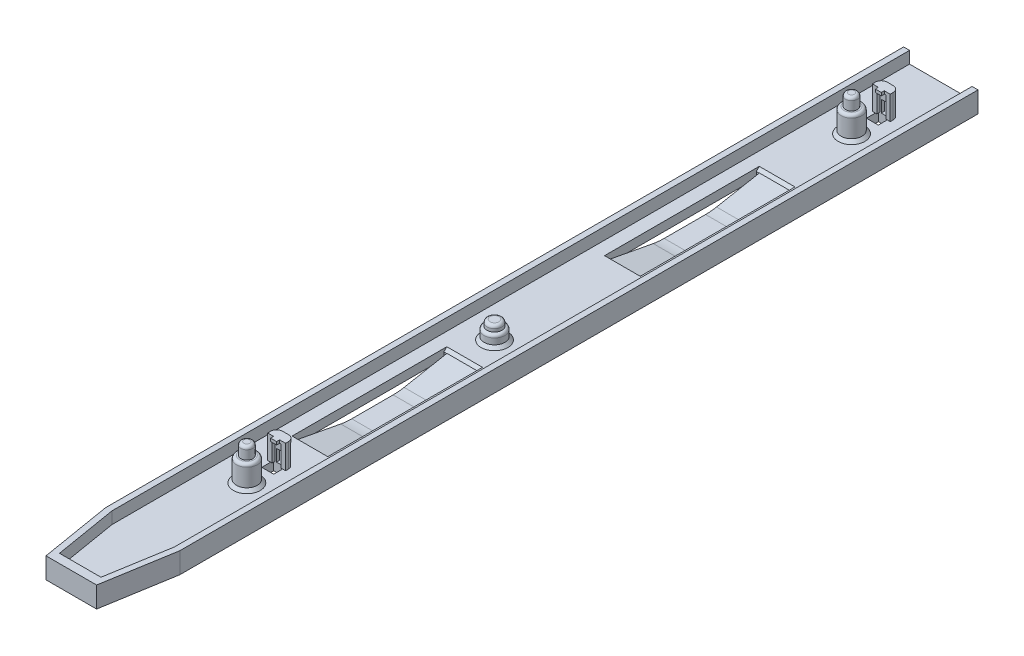
from build123d import *

# Parameters (mm, degrees)
SKETCH_1_W                   = 12.5
SKETCH_1_H                   = 146.1
EXTRUDE_1_DEPTH              = 3.5
CUT_EXTRUDE_1_DEPTH          = 74.400374658
CUT_EXTRUDE_2_DEPTH          = 2
SKETCH_7_W                   = 6
SKETCH_7_H                   = 25
CUT_EXTRUDE_3_DEPTH          = 74.344154505
EXTRUDE_2_DEPTH              = 2.5
PATTERN_LINEAR_1_COUNT       = 2
PATTERN_LINEAR_1_PITCH       = 52.5
FILLET_1_R                   = 10
CHAMFER_1_SIZE               = 0.5
SKETCH_11_R                  = 1.75
EXTRUDE_4_DEPTH              = 6
SKETCH_12_OUTSIDE_W          = 43.882
SKETCH_12_OUTSIDE_H          = 177.482
SKETCH_12_OUTSIDE_R          = 1
CUT_EXTRUDE_5_DEPTH          = 2
FILLET_3_R                   = 0.5
CHAMFER_3_SIZE               = 0.5
SKETCH_9_R                   = 1.75
EXTRUDE_3_DEPTH              = 3
CUT_EXTRUDE_START            = -1
SKETCH_10_R                  = 1.75
SKETCH_10_R_2                = 1.25
CUT_EXTRUDE_4_DEPTH          = 1
FILLET_2_R                   = 0.5
CHAMFER_2_SIZE               = 0.5
SKETCH_13_W                  = 2
SKETCH_13_H                  = 2
CUT_EXTRUDE_6_DEPTH          = 74.699491179
EXTRUDE_5_DEPTH              = 4
FILLET_4_R                   = 1
SKETCH_15_W                  = 1.5
SKETCH_15_H                  = 1
CUT_EXTRUDE_7_DEPTH          = 5
SKETCH_16_W                  = 3.5
SKETCH_16_H                  = 3.5
CUT_EXTRUDE_8_DEPTH          = 0.5
SKETCH_17_W                  = 1
SKETCH_17_H                  = 2
CUT_EXTRUDE_9_DEPTH          = 0.5
PATTERN_LINEAR_9_OUTLINE_W   = 2
PATTERN_LINEAR_9_OUTLINE_H   = 2
PATTERN_LINEAR_9_DEPTH       = 1.5
PATTERN_START                = 1.5
PATTERN_LINEAR_9_2_DEPTH     = 4
PATTERN_START_2              = 5
PATTERN_LINEAR_9_3_DEPTH     = 0.5
PATTERN_START_3              = 3.5
PATTERN_LINEAR_9_4_OUTLINE_W = 1
PATTERN_LINEAR_9_4_OUTLINE_H = 0.5
PATTERN_LINEAR_9_4_DEPTH     = 1.5
SKETCH_18_R                  = 0.5
CUT_EXTRUDE_10_DEPTH         = 2


# Read off the part's stored shape, not the designer's step: 阵列(线性)9
# Some blends are built 0.0001 mm under size
with BuildPart() as part:
    # 草图1 → 凸台-拉伸1 (new body)
    with BuildSketch(Plane(origin=(0, 0, 0), x_dir=(1, 0, 0), z_dir=(0, 1, 0))):
        Rectangle(SKETCH_1_W, SKETCH_1_H)
    extrude(amount=EXTRUDE_1_DEPTH)

    # 草图3 → 切除-拉伸1 (cut, through all)
    with BuildSketch(Plane(origin=(0, 3.5, 0), x_dir=(1, 0, 0), z_dir=(0, 1, 0))):
        Polygon((-6.25, -73.05), (-6.25, -61.05), (-4.25, -73.05), align=None)
    cut_extrude_1 = extrude(amount=-CUT_EXTRUDE_1_DEPTH, mode=Mode.SUBTRACT)

    # 镜向1: 切除-拉伸1 across plane
    add(cut_extrude_1.mirror(Plane(origin=(0, 0, 0), x_dir=(0, 0, 1), z_dir=(1, 0, 0))), mode=Mode.SUBTRACT)

    # 草图4 → 切除-拉伸2 (cut)
    with BuildSketch(Plane(origin=(0, 3.5, 0), x_dir=(1, 0, 0), z_dir=(0, 1, 0))):
        Polygon((-5.25, 73.05), (-5.25, -60.96723747), (-3.486206245, -71.55), (3.486206245, -71.55), (5.25, -60.96723747), (5.25, 73.05), align=None)
    extrude(amount=-CUT_EXTRUDE_2_DEPTH, mode=Mode.SUBTRACT)

    # 草图7 → 切除-拉伸3 (cut, through all)
    with BuildSketch(Plane(origin=(0, 1.5, 0), x_dir=(1, 0, 0), z_dir=(0, 1, 0))):
        with Locations((0, 32.55)):
            Rectangle(SKETCH_7_W, SKETCH_7_H)
        with Locations((0, -19.95)):
            Rectangle(SKETCH_7_W, SKETCH_7_H)
    extrude(amount=-CUT_EXTRUDE_3_DEPTH, mode=Mode.SUBTRACT)

    # 草图8 → 凸台-拉伸2 (add, symmetric)
    with BuildSketch(Plane(origin=(0, 0, 0), x_dir=(0, 0, -1), z_dir=(1, 0, 0))):
        Polygon((45.05, 0), (37.05, -1.5), (28.05, -1.5), (20.05, 0), (20.05, 1.017426287), (28.142940199, -0.5), (36.957059801, -0.5), (45.05, 1.017426287), align=None)
    extrude_2 = extrude(amount=EXTRUDE_2_DEPTH, both=True)

    # 阵列(线性)1: 凸台-拉伸2 ×2
    with Locations(*[(0, 0, i * PATTERN_LINEAR_1_PITCH) for i in range(1, PATTERN_LINEAR_1_COUNT)]):
        add(extrude_2)

    # 圆角1
    fillet_1_edges = [part.edges().sort_by_distance(p)[0] for p in [
        (0, -1.5, 24.45),
        (0, -1.5, 15.45),
        (0, -0.5, 15.542940199),
        (0, -0.5, 24.357059801),
        (0, -1.5, -28.05),
        (0, -1.5, -37.05),
        (0, -0.5, -36.957059801),
        (0, -0.5, -28.142940199),
    ]]
    fillet(fillet_1_edges, radius=FILLET_1_R)

    # 倒角1
    # the kernel refuses this chamfer: 0.5 mm, written as the material it takes off along each edge
    with BuildSketch(Plane(origin=(3, 1.5, 32.45), x_dir=(0, -0.999621916911297, -0.02749587661058218), z_dir=(-1, 0, 0))) as chamfer_1_piece_1_section:
        Polygon((CHAMFER_1_SIZE * 0.999621916911, CHAMFER_1_SIZE * 0.0274958766106), (-CHAMFER_1_SIZE * 0.0274958766106, CHAMFER_1_SIZE * 0.999621916911), (0, 0), align=None)
    chamfer_1_piece_1 = extrude(amount=6, mode=Mode.PRIVATE)
    chamfer_1_piece_1 = split(chamfer_1_piece_1, bisect_by=Plane(origin=(2.5, 1.004745153, 32.442397082), z_dir=(1, 0, 0)), keep=Keep.TOP, mode=Mode.PRIVATE)
    chamfer_1_piece_1 = split(chamfer_1_piece_1, bisect_by=Plane(origin=(2.75, 1.015618475, 32.440358334), z_dir=(0, -0.982872186934322, 0.18428853505018503)), keep=Keep.TOP, mode=Mode.PRIVATE)
    add(chamfer_1_piece_1, mode=Mode.SUBTRACT)
    with BuildSketch(Plane(origin=(3, 1.5, 32.45), x_dir=(0, -0.999621916911297, -0.02749587661058218), z_dir=(-1, 0, 0))) as chamfer_1_piece_2_section:
        Polygon((CHAMFER_1_SIZE * 0.999621916911, CHAMFER_1_SIZE * 0.0274958766106), (-CHAMFER_1_SIZE * 0.0274958766106, CHAMFER_1_SIZE * 0.999621916911), (0, 0), align=None)
    chamfer_1_piece_2 = extrude(amount=6, mode=Mode.PRIVATE)
    chamfer_1_piece_2 = split(chamfer_1_piece_2, bisect_by=Plane(origin=(2.5, 1.336949291, 32.615860775), z_dir=(1, 0, 0)), keep=Keep.TOP, mode=Mode.PRIVATE)
    chamfer_1_piece_2 = split(chamfer_1_piece_2, bisect_by=Plane(origin=(2.75, 1.058320718, 32.668103633), z_dir=(0, 0.982872186934322, -0.18428853505018503)), keep=Keep.TOP, mode=Mode.PRIVATE)
    add(chamfer_1_piece_2, mode=Mode.SUBTRACT)
    with BuildSketch(Plane(origin=(3, 1.5, 32.45), x_dir=(0, -0.999621916911297, -0.02749587661058218), z_dir=(-1, 0, 0))) as chamfer_1_piece_3_section:
        Polygon((CHAMFER_1_SIZE * 0.999621916911, CHAMFER_1_SIZE * 0.0274958766106), (-CHAMFER_1_SIZE * 0.0274958766106, CHAMFER_1_SIZE * 0.999621916911), (0, 0), align=None)
    chamfer_1_piece_3 = extrude(amount=6, mode=Mode.PRIVATE)
    chamfer_1_piece_3 = split(chamfer_1_piece_3, bisect_by=Plane(origin=(-2.5, 1.336949291, 32.615860775), z_dir=(1, 0, 0)), keep=Keep.TOP, mode=Mode.PRIVATE)
    chamfer_1_piece_3 = split(chamfer_1_piece_3, bisect_by=Plane(origin=(2.5, 1.336949291, 32.615860775), z_dir=(-1, 0, 0)), keep=Keep.TOP, mode=Mode.PRIVATE)
    chamfer_1_piece_3 = split(chamfer_1_piece_3, bisect_by=Plane(origin=(0, 1.058320718, 32.668103633), z_dir=(0, 0.982872186934322, -0.18428853505018503)), keep=Keep.TOP, mode=Mode.PRIVATE)
    add(chamfer_1_piece_3, mode=Mode.SUBTRACT)
    with BuildSketch(Plane(origin=(3, 1.5, 32.45), x_dir=(0, -0.999621916911297, -0.02749587661058218), z_dir=(-1, 0, 0))) as chamfer_1_piece_4_section:
        Polygon((CHAMFER_1_SIZE * 0.999621916911, CHAMFER_1_SIZE * 0.0274958766106), (-CHAMFER_1_SIZE * 0.0274958766106, CHAMFER_1_SIZE * 0.999621916911), (0, 0), align=None)
    chamfer_1_piece_4 = extrude(amount=6, mode=Mode.PRIVATE)
    chamfer_1_piece_4 = split(chamfer_1_piece_4, bisect_by=Plane(origin=(-2.5, 1.004745153, 32.442397082), z_dir=(-1, 0, 0)), keep=Keep.TOP, mode=Mode.PRIVATE)
    chamfer_1_piece_4 = split(chamfer_1_piece_4, bisect_by=Plane(origin=(-2.75, 1.015618475, 32.440358334), z_dir=(0, -0.982872186934322, 0.18428853505018503)), keep=Keep.TOP, mode=Mode.PRIVATE)
    add(chamfer_1_piece_4, mode=Mode.SUBTRACT)
    with BuildSketch(Plane(origin=(3, 1.5, 32.45), x_dir=(0, -0.999621916911297, -0.02749587661058218), z_dir=(-1, 0, 0))) as chamfer_1_piece_5_section:
        Polygon((CHAMFER_1_SIZE * 0.999621916911, CHAMFER_1_SIZE * 0.0274958766106), (-CHAMFER_1_SIZE * 0.0274958766106, CHAMFER_1_SIZE * 0.999621916911), (0, 0), align=None)
    chamfer_1_piece_5 = extrude(amount=6, mode=Mode.PRIVATE)
    chamfer_1_piece_5 = split(chamfer_1_piece_5, bisect_by=Plane(origin=(-2.5, 1.336949291, 32.615860775), z_dir=(-1, 0, 0)), keep=Keep.TOP, mode=Mode.PRIVATE)
    chamfer_1_piece_5 = split(chamfer_1_piece_5, bisect_by=Plane(origin=(-2.75, 1.058320718, 32.668103633), z_dir=(0, 0.982872186934322, -0.18428853505018503)), keep=Keep.TOP, mode=Mode.PRIVATE)
    add(chamfer_1_piece_5, mode=Mode.SUBTRACT)
    with BuildSketch(Plane(origin=(3, 1.5, -20.05), x_dir=(0, -0.9996219169112968, -0.02749587661058908), z_dir=(-1, 0, 0))) as chamfer_1_piece_6_section:
        Polygon((CHAMFER_1_SIZE * 0.999621916911, CHAMFER_1_SIZE * 0.0274958766106), (-CHAMFER_1_SIZE * 0.0274958766106, CHAMFER_1_SIZE * 0.999621916911), (0, 0), align=None)
    chamfer_1_piece_6 = extrude(amount=6, mode=Mode.PRIVATE)
    chamfer_1_piece_6 = split(chamfer_1_piece_6, bisect_by=Plane(origin=(2.75, 1.015618475, -20.059641666), z_dir=(0, -0.982872186934322, 0.18428853505018503)), keep=Keep.TOP, mode=Mode.PRIVATE)
    chamfer_1_piece_6 = split(chamfer_1_piece_6, bisect_by=Plane(origin=(2.5, 1.004745153, -20.057602918), z_dir=(1, 0, 0)), keep=Keep.TOP, mode=Mode.PRIVATE)
    add(chamfer_1_piece_6, mode=Mode.SUBTRACT)
    with BuildSketch(Plane(origin=(3, 1.5, -20.05), x_dir=(0, -0.9996219169112968, -0.02749587661058908), z_dir=(-1, 0, 0))) as chamfer_1_piece_7_section:
        Polygon((CHAMFER_1_SIZE * 0.999621916911, CHAMFER_1_SIZE * 0.0274958766106), (-CHAMFER_1_SIZE * 0.0274958766106, CHAMFER_1_SIZE * 0.999621916911), (0, 0), align=None)
    chamfer_1_piece_7 = extrude(amount=6, mode=Mode.PRIVATE)
    chamfer_1_piece_7 = split(chamfer_1_piece_7, bisect_by=Plane(origin=(2.75, 1.058320718, -19.831896367), z_dir=(0, 0.982872186934322, -0.18428853505018503)), keep=Keep.TOP, mode=Mode.PRIVATE)
    chamfer_1_piece_7 = split(chamfer_1_piece_7, bisect_by=Plane(origin=(2.5, 1.336949291, -19.884139225), z_dir=(1, 0, 0)), keep=Keep.TOP, mode=Mode.PRIVATE)
    add(chamfer_1_piece_7, mode=Mode.SUBTRACT)
    with BuildSketch(Plane(origin=(3, 1.5, -20.05), x_dir=(0, -0.9996219169112968, -0.02749587661058908), z_dir=(-1, 0, 0))) as chamfer_1_piece_8_section:
        Polygon((CHAMFER_1_SIZE * 0.999621916911, CHAMFER_1_SIZE * 0.0274958766106), (-CHAMFER_1_SIZE * 0.0274958766106, CHAMFER_1_SIZE * 0.999621916911), (0, 0), align=None)
    chamfer_1_piece_8 = extrude(amount=6, mode=Mode.PRIVATE)
    chamfer_1_piece_8 = split(chamfer_1_piece_8, bisect_by=Plane(origin=(-2.5, 1.336949291, -19.884139225), z_dir=(1, 0, 0)), keep=Keep.TOP, mode=Mode.PRIVATE)
    chamfer_1_piece_8 = split(chamfer_1_piece_8, bisect_by=Plane(origin=(0, 1.058320718, -19.831896367), z_dir=(0, 0.982872186934322, -0.18428853505018503)), keep=Keep.TOP, mode=Mode.PRIVATE)
    chamfer_1_piece_8 = split(chamfer_1_piece_8, bisect_by=Plane(origin=(2.5, 1.336949291, -19.884139225), z_dir=(-1, 0, 0)), keep=Keep.TOP, mode=Mode.PRIVATE)
    add(chamfer_1_piece_8, mode=Mode.SUBTRACT)
    with BuildSketch(Plane(origin=(3, 1.5, -20.05), x_dir=(0, -0.9996219169112968, -0.02749587661058908), z_dir=(-1, 0, 0))) as chamfer_1_piece_9_section:
        Polygon((CHAMFER_1_SIZE * 0.999621916911, CHAMFER_1_SIZE * 0.0274958766106), (-CHAMFER_1_SIZE * 0.0274958766106, CHAMFER_1_SIZE * 0.999621916911), (0, 0), align=None)
    chamfer_1_piece_9 = extrude(amount=6, mode=Mode.PRIVATE)
    chamfer_1_piece_9 = split(chamfer_1_piece_9, bisect_by=Plane(origin=(-2.5, 1.004745153, -20.057602918), z_dir=(-1, 0, 0)), keep=Keep.TOP, mode=Mode.PRIVATE)
    chamfer_1_piece_9 = split(chamfer_1_piece_9, bisect_by=Plane(origin=(-2.75, 1.015618475, -20.059641666), z_dir=(0, -0.982872186934322, 0.18428853505018503)), keep=Keep.TOP, mode=Mode.PRIVATE)
    add(chamfer_1_piece_9, mode=Mode.SUBTRACT)
    with BuildSketch(Plane(origin=(3, 1.5, -20.05), x_dir=(0, -0.9996219169112968, -0.02749587661058908), z_dir=(-1, 0, 0))) as chamfer_1_piece_10_section:
        Polygon((CHAMFER_1_SIZE * 0.999621916911, CHAMFER_1_SIZE * 0.0274958766106), (-CHAMFER_1_SIZE * 0.0274958766106, CHAMFER_1_SIZE * 0.999621916911), (0, 0), align=None)
    chamfer_1_piece_10 = extrude(amount=6, mode=Mode.PRIVATE)
    chamfer_1_piece_10 = split(chamfer_1_piece_10, bisect_by=Plane(origin=(-2.5, 1.336949291, -19.884139225), z_dir=(-1, 0, 0)), keep=Keep.TOP, mode=Mode.PRIVATE)
    chamfer_1_piece_10 = split(chamfer_1_piece_10, bisect_by=Plane(origin=(-2.75, 1.058320718, -19.831896367), z_dir=(0, 0.982872186934322, -0.18428853505018503)), keep=Keep.TOP, mode=Mode.PRIVATE)
    add(chamfer_1_piece_10, mode=Mode.SUBTRACT)
    with BuildSketch(Plane(origin=(-3, 1.5, -45.05), x_dir=(0, -0.999621916911297, 0.02749587661058218), z_dir=(1, 0, 0))) as chamfer_1_piece_11_section:
        Polygon((CHAMFER_1_SIZE * 0.999621916911, CHAMFER_1_SIZE * 0.0274958766106), (-CHAMFER_1_SIZE * 0.0274958766106, CHAMFER_1_SIZE * 0.999621916911), (0, 0), align=None)
    chamfer_1_piece_11 = extrude(amount=6, mode=Mode.PRIVATE)
    chamfer_1_piece_11 = split(chamfer_1_piece_11, bisect_by=Plane(origin=(-2.75, 1.015618475, -45.040358334), z_dir=(0, -0.982872186934322, -0.1842885350501852)), keep=Keep.TOP, mode=Mode.PRIVATE)
    chamfer_1_piece_11 = split(chamfer_1_piece_11, bisect_by=Plane(origin=(-2.5, 1.004745153, -45.042397082), z_dir=(-1, 0, 0)), keep=Keep.TOP, mode=Mode.PRIVATE)
    add(chamfer_1_piece_11, mode=Mode.SUBTRACT)
    with BuildSketch(Plane(origin=(-3, 1.5, -45.05), x_dir=(0, -0.999621916911297, 0.02749587661058218), z_dir=(1, 0, 0))) as chamfer_1_piece_12_section:
        Polygon((CHAMFER_1_SIZE * 0.999621916911, CHAMFER_1_SIZE * 0.0274958766106), (-CHAMFER_1_SIZE * 0.0274958766106, CHAMFER_1_SIZE * 0.999621916911), (0, 0), align=None)
    chamfer_1_piece_12 = extrude(amount=6, mode=Mode.PRIVATE)
    chamfer_1_piece_12 = split(chamfer_1_piece_12, bisect_by=Plane(origin=(-2.75, 1.058320718, -45.268103633), z_dir=(0, 0.982872186934322, 0.1842885350501852)), keep=Keep.TOP, mode=Mode.PRIVATE)
    chamfer_1_piece_12 = split(chamfer_1_piece_12, bisect_by=Plane(origin=(-2.5, 1.336949291, -45.215860775), z_dir=(-1, 0, 0)), keep=Keep.TOP, mode=Mode.PRIVATE)
    add(chamfer_1_piece_12, mode=Mode.SUBTRACT)
    with BuildSketch(Plane(origin=(-3, 1.5, -45.05), x_dir=(0, -0.999621916911297, 0.02749587661058218), z_dir=(1, 0, 0))) as chamfer_1_piece_13_section:
        Polygon((CHAMFER_1_SIZE * 0.999621916911, CHAMFER_1_SIZE * 0.0274958766106), (-CHAMFER_1_SIZE * 0.0274958766106, CHAMFER_1_SIZE * 0.999621916911), (0, 0), align=None)
    chamfer_1_piece_13 = extrude(amount=6, mode=Mode.PRIVATE)
    chamfer_1_piece_13 = split(chamfer_1_piece_13, bisect_by=Plane(origin=(2.5, 1.336949291, -45.215860775), z_dir=(-1, 0, 0)), keep=Keep.TOP, mode=Mode.PRIVATE)
    chamfer_1_piece_13 = split(chamfer_1_piece_13, bisect_by=Plane(origin=(0, 1.058320718, -45.268103633), z_dir=(0, 0.982872186934322, 0.1842885350501852)), keep=Keep.TOP, mode=Mode.PRIVATE)
    chamfer_1_piece_13 = split(chamfer_1_piece_13, bisect_by=Plane(origin=(-2.5, 1.336949291, -45.215860775), z_dir=(1, 0, 0)), keep=Keep.TOP, mode=Mode.PRIVATE)
    add(chamfer_1_piece_13, mode=Mode.SUBTRACT)
    with BuildSketch(Plane(origin=(-3, 1.5, -45.05), x_dir=(0, -0.999621916911297, 0.02749587661058218), z_dir=(1, 0, 0))) as chamfer_1_piece_14_section:
        Polygon((CHAMFER_1_SIZE * 0.999621916911, CHAMFER_1_SIZE * 0.0274958766106), (-CHAMFER_1_SIZE * 0.0274958766106, CHAMFER_1_SIZE * 0.999621916911), (0, 0), align=None)
    chamfer_1_piece_14 = extrude(amount=6, mode=Mode.PRIVATE)
    chamfer_1_piece_14 = split(chamfer_1_piece_14, bisect_by=Plane(origin=(2.5, 1.004745153, -45.042397082), z_dir=(1, 0, 0)), keep=Keep.TOP, mode=Mode.PRIVATE)
    chamfer_1_piece_14 = split(chamfer_1_piece_14, bisect_by=Plane(origin=(2.75, 1.015618475, -45.040358334), z_dir=(0, -0.982872186934322, -0.1842885350501852)), keep=Keep.TOP, mode=Mode.PRIVATE)
    add(chamfer_1_piece_14, mode=Mode.SUBTRACT)
    with BuildSketch(Plane(origin=(-3, 1.5, -45.05), x_dir=(0, -0.999621916911297, 0.02749587661058218), z_dir=(1, 0, 0))) as chamfer_1_piece_15_section:
        Polygon((CHAMFER_1_SIZE * 0.999621916911, CHAMFER_1_SIZE * 0.0274958766106), (-CHAMFER_1_SIZE * 0.0274958766106, CHAMFER_1_SIZE * 0.999621916911), (0, 0), align=None)
    chamfer_1_piece_15 = extrude(amount=6, mode=Mode.PRIVATE)
    chamfer_1_piece_15 = split(chamfer_1_piece_15, bisect_by=Plane(origin=(2.5, 1.336949291, -45.215860775), z_dir=(1, 0, 0)), keep=Keep.TOP, mode=Mode.PRIVATE)
    chamfer_1_piece_15 = split(chamfer_1_piece_15, bisect_by=Plane(origin=(2.75, 1.058320718, -45.268103633), z_dir=(0, 0.982872186934322, 0.1842885350501852)), keep=Keep.TOP, mode=Mode.PRIVATE)
    add(chamfer_1_piece_15, mode=Mode.SUBTRACT)
    with BuildSketch(Plane(origin=(-3, 1.5, 7.45), x_dir=(0, -0.9996219169112968, 0.02749587661058563), z_dir=(1, 0, 0))) as chamfer_1_piece_16_section:
        Polygon((CHAMFER_1_SIZE * 0.999621916911, CHAMFER_1_SIZE * 0.0274958766106), (-CHAMFER_1_SIZE * 0.0274958766106, CHAMFER_1_SIZE * 0.999621916911), (0, 0), align=None)
    chamfer_1_piece_16 = extrude(amount=6, mode=Mode.PRIVATE)
    chamfer_1_piece_16 = split(chamfer_1_piece_16, bisect_by=Plane(origin=(-2.5, 1.004745153, 7.457602918), z_dir=(-1, 0, 0)), keep=Keep.TOP, mode=Mode.PRIVATE)
    chamfer_1_piece_16 = split(chamfer_1_piece_16, bisect_by=Plane(origin=(-2.75, 1.015618475, 7.459641666), z_dir=(0, -0.982872186934322, -0.1842885350501852)), keep=Keep.TOP, mode=Mode.PRIVATE)
    add(chamfer_1_piece_16, mode=Mode.SUBTRACT)
    with BuildSketch(Plane(origin=(-3, 1.5, 7.45), x_dir=(0, -0.9996219169112968, 0.02749587661058563), z_dir=(1, 0, 0))) as chamfer_1_piece_17_section:
        Polygon((CHAMFER_1_SIZE * 0.999621916911, CHAMFER_1_SIZE * 0.0274958766106), (-CHAMFER_1_SIZE * 0.0274958766106, CHAMFER_1_SIZE * 0.999621916911), (0, 0), align=None)
    chamfer_1_piece_17 = extrude(amount=6, mode=Mode.PRIVATE)
    chamfer_1_piece_17 = split(chamfer_1_piece_17, bisect_by=Plane(origin=(-2.5, 1.336949291, 7.284139225), z_dir=(-1, 0, 0)), keep=Keep.TOP, mode=Mode.PRIVATE)
    chamfer_1_piece_17 = split(chamfer_1_piece_17, bisect_by=Plane(origin=(-2.75, 1.058320718, 7.231896367), z_dir=(0, 0.982872186934322, 0.1842885350501852)), keep=Keep.TOP, mode=Mode.PRIVATE)
    add(chamfer_1_piece_17, mode=Mode.SUBTRACT)
    with BuildSketch(Plane(origin=(-3, 1.5, 7.45), x_dir=(0, -0.9996219169112968, 0.02749587661058563), z_dir=(1, 0, 0))) as chamfer_1_piece_18_section:
        Polygon((CHAMFER_1_SIZE * 0.999621916911, CHAMFER_1_SIZE * 0.0274958766106), (-CHAMFER_1_SIZE * 0.0274958766106, CHAMFER_1_SIZE * 0.999621916911), (0, 0), align=None)
    chamfer_1_piece_18 = extrude(amount=6, mode=Mode.PRIVATE)
    chamfer_1_piece_18 = split(chamfer_1_piece_18, bisect_by=Plane(origin=(-2.5, 1.336949291, 7.284139225), z_dir=(1, 0, 0)), keep=Keep.TOP, mode=Mode.PRIVATE)
    chamfer_1_piece_18 = split(chamfer_1_piece_18, bisect_by=Plane(origin=(2.5, 1.336949291, 7.284139225), z_dir=(-1, 0, 0)), keep=Keep.TOP, mode=Mode.PRIVATE)
    chamfer_1_piece_18 = split(chamfer_1_piece_18, bisect_by=Plane(origin=(0, 1.058320718, 7.231896367), z_dir=(0, 0.982872186934322, 0.1842885350501852)), keep=Keep.TOP, mode=Mode.PRIVATE)
    add(chamfer_1_piece_18, mode=Mode.SUBTRACT)
    with BuildSketch(Plane(origin=(-3, 1.5, 7.45), x_dir=(0, -0.9996219169112968, 0.02749587661058563), z_dir=(1, 0, 0))) as chamfer_1_piece_19_section:
        Polygon((CHAMFER_1_SIZE * 0.999621916911, CHAMFER_1_SIZE * 0.0274958766106), (-CHAMFER_1_SIZE * 0.0274958766106, CHAMFER_1_SIZE * 0.999621916911), (0, 0), align=None)
    chamfer_1_piece_19 = extrude(amount=6, mode=Mode.PRIVATE)
    chamfer_1_piece_19 = split(chamfer_1_piece_19, bisect_by=Plane(origin=(2.5, 1.004745153, 7.457602918), z_dir=(1, 0, 0)), keep=Keep.TOP, mode=Mode.PRIVATE)
    chamfer_1_piece_19 = split(chamfer_1_piece_19, bisect_by=Plane(origin=(2.75, 1.015618475, 7.459641666), z_dir=(0, -0.982872186934322, -0.1842885350501852)), keep=Keep.TOP, mode=Mode.PRIVATE)
    add(chamfer_1_piece_19, mode=Mode.SUBTRACT)
    with BuildSketch(Plane(origin=(-3, 1.5, 7.45), x_dir=(0, -0.9996219169112968, 0.02749587661058563), z_dir=(1, 0, 0))) as chamfer_1_piece_20_section:
        Polygon((CHAMFER_1_SIZE * 0.999621916911, CHAMFER_1_SIZE * 0.0274958766106), (-CHAMFER_1_SIZE * 0.0274958766106, CHAMFER_1_SIZE * 0.999621916911), (0, 0), align=None)
    chamfer_1_piece_20 = extrude(amount=6, mode=Mode.PRIVATE)
    chamfer_1_piece_20 = split(chamfer_1_piece_20, bisect_by=Plane(origin=(2.5, 1.336949291, 7.284139225), z_dir=(1, 0, 0)), keep=Keep.TOP, mode=Mode.PRIVATE)
    chamfer_1_piece_20 = split(chamfer_1_piece_20, bisect_by=Plane(origin=(2.75, 1.058320718, 7.231896367), z_dir=(0, 0.982872186934322, 0.1842885350501852)), keep=Keep.TOP, mode=Mode.PRIVATE)
    add(chamfer_1_piece_20, mode=Mode.SUBTRACT)

    # 草图11 → 凸台-拉伸4 (add)
    with BuildSketch(Plane(origin=(0, 1.5, 0), x_dir=(1, 0, 0), z_dir=(0, 1, 0))):
        with Locations(Location((0, 58.05, 0), (0, 0, 270))):
            Circle(SKETCH_11_R)
        with Locations(Location((0, -43.55, 0), (0, 0, 270))):
            Circle(SKETCH_11_R)
    extrude(amount=EXTRUDE_4_DEPTH)

    # 草图12 outside → 切除-拉伸5 (cut)
    with BuildSketch(Plane(origin=(0, 7.5, 0), x_dir=(1, 0, 0), z_dir=(0, 1, 0))):
        Rectangle(SKETCH_12_OUTSIDE_W, SKETCH_12_OUTSIDE_H)
        with Locations(Location((0, 58.05, 0), (0, 0, 270))):
            Circle(SKETCH_12_OUTSIDE_R, mode=Mode.SUBTRACT)
        with Locations(Location((0, -43.55, 0), (0, 0, 270))):
            Circle(SKETCH_12_OUTSIDE_R, mode=Mode.SUBTRACT)
    extrude(amount=-CUT_EXTRUDE_5_DEPTH, mode=Mode.SUBTRACT)

    # 圆角3
    fillet_3_edges = [part.edges().sort_by_distance(p)[0] for p in [
        (0, 5.5, -59.8),
        (0, 5.5, 41.8),
        (0, 7.5, -59.05),
        (0, 7.5, 42.55),
    ]]
    fillet(fillet_3_edges, radius=FILLET_3_R)

    # 倒角3
    chamfer_3_edges = [part.edges().sort_by_distance(p)[0] for p in [
        (0, 1.5, -59.8),
        (0, 1.5, 41.8),
    ]]
    chamfer(chamfer_3_edges, length=CHAMFER_3_SIZE)

    # 草图9 → 凸台-拉伸3 (add)
    with BuildSketch(Plane(origin=(0, 1.5, 0), x_dir=(1, 0, 0), z_dir=(0, 1, 0))):
        with Locations(Location((0, -1.94, 0), (0, 0, 270))):
            Circle(SKETCH_9_R)
    extrude(amount=EXTRUDE_3_DEPTH)

    # 草图10 → 切除-拉伸4 (cut)
    with BuildSketch(Plane(origin=(0, 4.5, 0), x_dir=(1, 0, 0), z_dir=(0, 1, 0)).offset(CUT_EXTRUDE_START)):
        with Locations(Location((0, -1.94, 0), (0, 0, 270))):
            Circle(SKETCH_10_R)
        with Locations(Location((0, -1.94, 0), (0, 0, 270))):
            Circle(SKETCH_10_R_2, mode=Mode.SUBTRACT)
    extrude(amount=CUT_EXTRUDE_4_DEPTH, mode=Mode.SUBTRACT)

    # 圆角2
    fillet_2_edges = [part.edges().sort_by_distance(p)[0] for p in [
        (0, 3.5, 0.19),
        (0, 4.5, 0.69),
    ]]
    fillet(fillet_2_edges, radius=FILLET_2_R - 0.0001)  # a hair under: the kernel refuses the full size

    # 倒角2
    chamfer_2_edges = [part.edges().sort_by_distance(p)[0] for p in [
        (0, 1.5, 0.19),
    ]]
    chamfer(chamfer_2_edges, length=CHAMFER_2_SIZE)

    # 草图13 → 切除-拉伸6 (cut, through all)
    with BuildSketch(Plane.XZ):
        with Locations((0, -62.55)):
            Rectangle(SKETCH_13_W, SKETCH_13_H)
    extrude(amount=-CUT_EXTRUDE_6_DEPTH, mode=Mode.SUBTRACT)

    # 草图14 → 凸台-拉伸5 (add)
    with BuildSketch(Plane(origin=(0, 1.5, 0), x_dir=(1, 0, 0), z_dir=(0, 1, 0))):
        Polygon((-1.5, 64.55), (1.5, 64.55), (1.5, 63.05), (0.5, 63.05), (0.5, 62.55), (-0.5, 62.55), (-0.5, 63.05), (-1.5, 63.05), align=None)
    extrude(amount=EXTRUDE_5_DEPTH)

    # 圆角4
    fillet_4_edges = [part.edges().sort_by_distance(p)[0] for p in [
        (-1.5, 3.5, -64.55),
        (1.5, 3.5, -64.55),
    ]]
    fillet(fillet_4_edges, radius=FILLET_4_R)

    # 草图15 → 切除-拉伸7 (cut)
    with BuildSketch(Plane.XZ):
        with Locations((0, -63.05)):
            Rectangle(SKETCH_15_W, SKETCH_15_H)
    extrude(amount=-CUT_EXTRUDE_7_DEPTH, mode=Mode.SUBTRACT)

    # 草图16 → 切除-拉伸8 (cut)
    with BuildSketch(Plane(origin=(0, 0, -64.55), x_dir=(-1, 0, 0), z_dir=(0, 0, -1))):
        with Locations((0, 3.25)):
            Rectangle(SKETCH_16_W, SKETCH_16_H)
    extrude(amount=-CUT_EXTRUDE_8_DEPTH, mode=Mode.SUBTRACT)

    # 草图17 → 切除-拉伸9 (cut)
    with BuildSketch(Plane(origin=(0, 0, -64.05), x_dir=(-1, 0, 0), z_dir=(0, 0, -1))):
        with Locations((0, 2.5)):
            Rectangle(SKETCH_17_W, SKETCH_17_H)
    extrude(amount=-CUT_EXTRUDE_9_DEPTH, mode=Mode.SUBTRACT)

    # 阵列(线性)9 outline → 阵列(线性)9 (cut)
    with BuildSketch(Plane(origin=(0, 0, 0), x_dir=(1, 0, 0), z_dir=(0, 1, 0))):
        with Locations((0, -39.05)):
            Rectangle(PATTERN_LINEAR_9_OUTLINE_W, PATTERN_LINEAR_9_OUTLINE_H)
    extrude(amount=PATTERN_LINEAR_9_DEPTH, mode=Mode.SUBTRACT)

    # Pattern Linear 9 2 outline → Pattern Linear 9 2 (add)
    with BuildSketch(Plane(origin=(0, 0, 0), x_dir=(1, 0, 0), z_dir=(0, 1, 0)).offset(PATTERN_START)):
        with BuildLine():
            Line((-0.75, -38.55), (-0.75, -38.05))
            Line((-0.75, -38.05), (-0.5, -38.05))
            Line((-0.5, -38.05), (-0.5, -37.55))
            Line((-0.5, -37.55), (-1.366025404, -37.55))
            ThreePointArc((-1.366025404, -37.55), (-1.465925826, -37.791180955), (-1.5, -38.05))
            Line((-1.5, -38.05), (-1.5, -38.55))
            Line((-1.5, -38.55), (-0.75, -38.55))
        make_face()
        with BuildLine():
            Line((0.75, -38.05), (0.75, -38.55))
            Line((0.75, -38.55), (1.5, -38.55))
            Line((1.5, -38.55), (1.5, -38.05))
            ThreePointArc((1.5, -38.05), (1.465925826, -37.791180955), (1.366025404, -37.55))
            Line((1.366025404, -37.55), (0.5, -37.55))
            Line((0.5, -37.55), (0.5, -38.05))
            Line((0.5, -38.05), (0.75, -38.05))
        make_face()
    extrude(amount=PATTERN_LINEAR_9_2_DEPTH)

    # Pattern Linear 9 3 outline → Pattern Linear 9 3 (add)
    with BuildSketch(Plane(origin=(0, 0, 0), x_dir=(1, 0, 0), z_dir=(0, 1, 0)).offset(PATTERN_START_2)):
        with BuildLine():
            Line((-0.5, -38.55), (-0.5, -39.05))
            Line((-0.5, -39.05), (0.5, -39.05))
            Line((0.5, -39.05), (0.5, -38.55))
            Line((0.5, -38.55), (0.75, -38.55))
            Line((0.75, -38.55), (0.75, -38.05))
            Line((0.75, -38.05), (0.5, -38.05))
            Line((0.5, -38.05), (0.5, -37.55))
            Line((0.5, -37.55), (1.366025404, -37.55))
            ThreePointArc((1.366025404, -37.55), (1, -37.183974596), (0.5, -37.05))
            Line((0.5, -37.05), (-0.5, -37.05))
            ThreePointArc((-0.5, -37.05), (-1, -37.183974596), (-1.366025404, -37.55))
            Line((-1.366025404, -37.55), (-0.5, -37.55))
            Line((-0.5, -37.55), (-0.5, -38.05))
            Line((-0.5, -38.05), (-0.75, -38.05))
            Line((-0.75, -38.05), (-0.75, -38.55))
            Line((-0.75, -38.55), (-0.5, -38.55))
        make_face()
    extrude(amount=PATTERN_LINEAR_9_3_DEPTH)

    # Pattern Linear 9 4 outline → Pattern Linear 9 4 (add)
    with BuildSketch(Plane(origin=(0, 0, 0), x_dir=(1, 0, 0), z_dir=(0, 1, 0)).offset(PATTERN_START_3)):
        with Locations((0, -37.8)):
            Rectangle(PATTERN_LINEAR_9_4_OUTLINE_W, PATTERN_LINEAR_9_4_OUTLINE_H)
    extrude(amount=PATTERN_LINEAR_9_4_DEPTH)

    # 草图18 → 切除-拉伸10 (cut)
    with BuildSketch(Plane.XZ):
        with Locations(Location((0, 43.55, 0), (0, 0, 270))):
            Circle(SKETCH_18_R)
        with Locations(Location((0, 1.94, 0), (0, 0, 270))):
            Circle(SKETCH_18_R)
        with Locations(Location((0, -58.05, 0), (0, 0, 270))):
            Circle(SKETCH_18_R)
    extrude(amount=-CUT_EXTRUDE_10_DEPTH, mode=Mode.SUBTRACT)


solid = part.part
